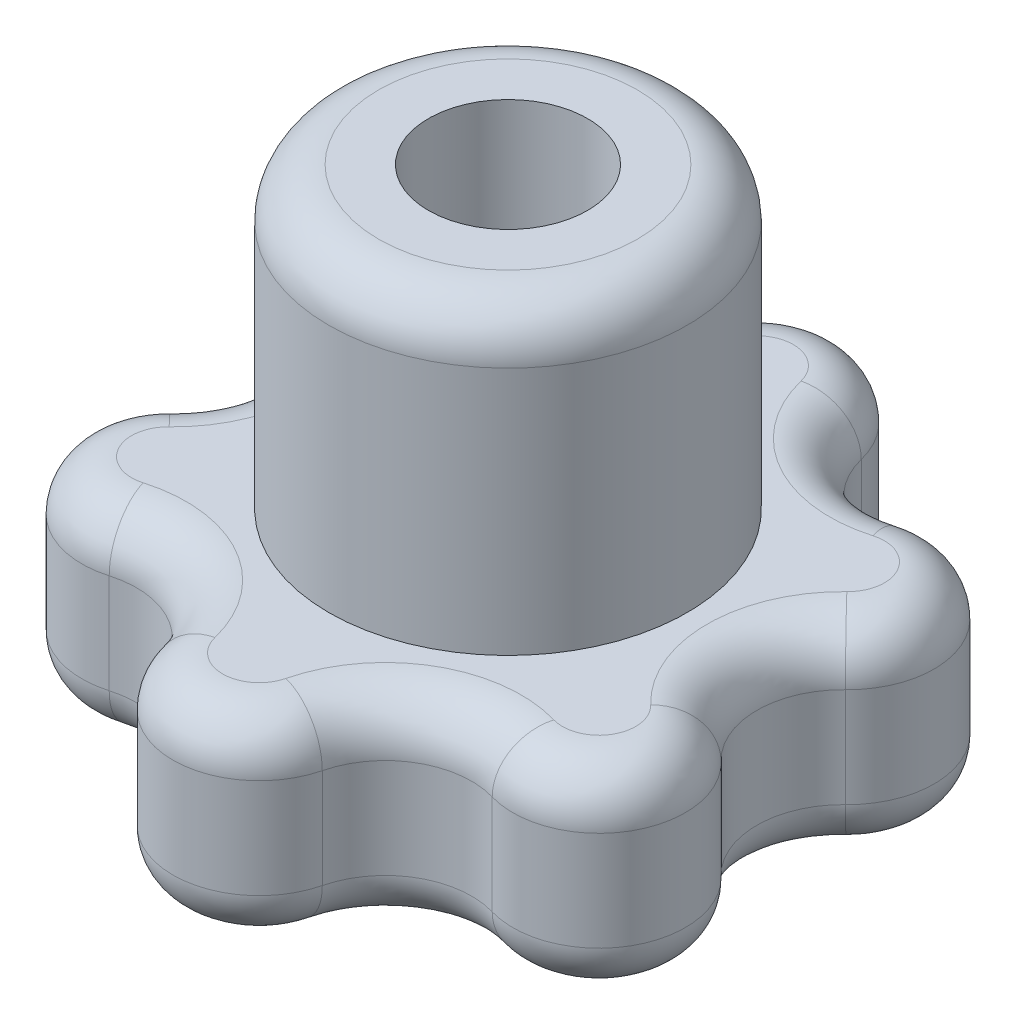
from build123d import *

# Parameters (mm, degrees)
EXTRUDE_1_DEPTH     = 4
SKETCH_2_R          = 3.6
EXTRUDE_2_DEPTH     = 6
SKETCH_3_R          = 1.6
CUT_EXTRUDE_1_DEPTH = 14.495364305
CUT_EXTRUDE_2_DEPTH = 2.5
FILLET_1_R          = 1


with BuildPart() as part:
    # Эскиз1 → Бобышка-Вытянуть1 (new body)
    with BuildSketch(Plane(origin=(0, 0, 0), x_dir=(1, 0, 0), z_dir=(0, 1, 0))):
        with BuildLine():
            ThreePointArc((1.683543611, 5.415983072), (0, 6.734174445), (-1.683543611, 5.415983072))
            ThreePointArc((-1.683543611, 5.415983072), (-2.5, 4.330127019), (-3.848607121, 4.165983072))
            ThreePointArc((-3.848607121, 4.165983072), (-5.831966143, 3.367087223), (-5.532150732, 1.25))
            ThreePointArc((-5.532150732, 1.25), (-5, 0), (-5.532150732, -1.25))
            ThreePointArc((-5.532150732, -1.25), (-5.831966143, -3.367087223), (-3.848607121, -4.165983072))
            ThreePointArc((-3.848607121, -4.165983072), (-2.5, -4.330127019), (-1.683543611, -5.415983072))
            ThreePointArc((-1.683543611, -5.415983072), (0, -6.734174445), (1.683543611, -5.415983072))
            ThreePointArc((1.683543611, -5.415983072), (2.5, -4.330127019), (3.848607121, -4.165983072))
            ThreePointArc((3.848607121, -4.165983072), (5.831966143, -3.367087223), (5.532150732, -1.25))
            ThreePointArc((5.532150732, -1.25), (5, 0), (5.532150732, 1.25))
            ThreePointArc((5.532150732, 1.25), (5.831966143, 3.367087223), (3.848607121, 4.165983072))
            ThreePointArc((3.848607121, 4.165983072), (2.5, 4.330127019), (1.683543611, 5.415983072))
        make_face()
    extrude(amount=EXTRUDE_1_DEPTH)

    # Эскиз2 → Бобышка-Вытянуть2 (add)
    with BuildSketch(Plane(origin=(0, 4, 0), x_dir=(1, 0, 0), z_dir=(0, 1, 0))):
        Circle(SKETCH_2_R)
    extrude(amount=EXTRUDE_2_DEPTH)

    # Эскиз3 → Вырез-Вытянуть1 (cut, through all)
    with BuildSketch(Plane(origin=(0, 10, 0), x_dir=(1, 0, 0), z_dir=(0, 1, 0))):
        Circle(SKETCH_3_R)
    extrude(amount=-CUT_EXTRUDE_1_DEPTH, mode=Mode.SUBTRACT)

    # Эскиз1<3> → Вырез-Вытянуть2 (cut)
    with BuildSketch(Plane(origin=(0, 0, 0), x_dir=(1, 0, 0), z_dir=(0, 1, 0))):
        Polygon((0, 3.348631561), (-2.9, 1.674315781), (-2.9, -1.674315781), (0, -3.348631561), (2.9, -1.674315781), (2.9, 1.674315781), align=None)
    extrude(amount=CUT_EXTRUDE_2_DEPTH, mode=Mode.SUBTRACT)

    # Скругление1
    fillet_1_edges = [part.edges().sort_by_distance(p)[0] for p in [
        (-2.5, 4, 4.330127019),
        (-5.831966143, 4, 3.367087223),
        (-5, 4, 0),
        (-5.831966143, 4, -3.367087223),
        (-2.5, 4, -4.330127019),
        (0, 4, -6.734174445),
        (2.5, 4, -4.330127019),
        (5.831966143, 4, -3.367087223),
        (5, 4, 0),
        (5.831966143, 4, 3.367087223),
        (2.5, 4, 4.330127019),
        (-2.5, 0, 4.330127019),
        (-5.831966143, 0, 3.367087223),
        (-5, 0, 0),
        (-5.831966143, 0, -3.367087223),
        (-2.5, 0, -4.330127019),
        (0, 0, -6.734174445),
        (2.5, 0, -4.330127019),
        (5.831966143, 0, -3.367087223),
        (5, 0, 0),
        (5.831966143, 0, 3.367087223),
        (2.5, 0, 4.330127019),
        (-3.6, 10, 0),
        (0, 4, 6.734174445),
        (0, 0, 6.734174445),
    ]]
    fillet(fillet_1_edges, radius=FILLET_1_R)


solid = part.part
